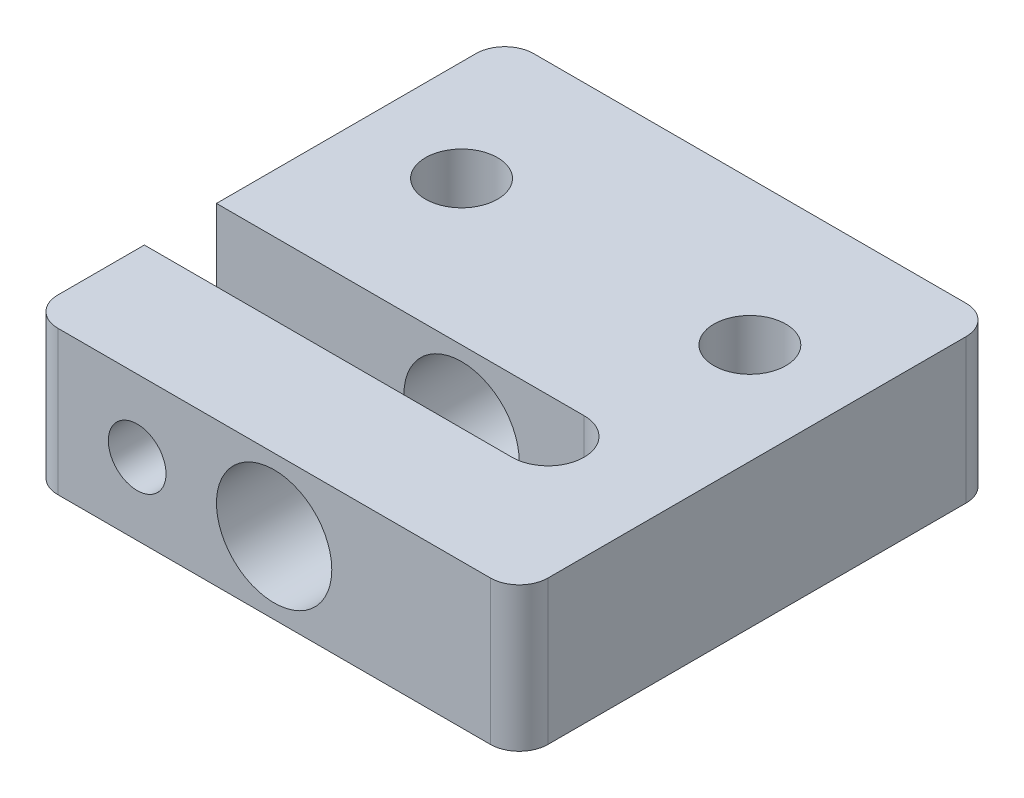
from build123d import *

# Parameters (mm, degrees)
SKETCH2_W           = 34
SKETCH2_H           = 33
BOSS_EXTRUDE1_DEPTH = 10
FILLET1_R           = 2
FILLET2_R           = 2
FILLET3_R           = 2
FILLET4_R           = 2
SKETCH3_R           = 2.5
CUT_EXTRUDE1_DEPTH  = 10
SKETCH4_W           = 28
SKETCH4_H           = 5
CUT_EXTRUDE2_DEPTH  = 10
FILLET5_R           = 2.5
FILLET6_R           = 2.5
SKETCH5_R           = 4
CUT_EXTRUDE3_DEPTH  = 60
SKETCH6_R           = 2
CUT_EXTRUDE4_DEPTH  = 10


with BuildPart() as part:
    # Sketch2 → Boss-Extrude1 (new body)
    with BuildSketch(Plane(origin=(0, 0, 0), x_dir=(1, 0, 0), z_dir=(0, 1, 0))):
        with Locations((17, 16.5)):
            Rectangle(SKETCH2_W, SKETCH2_H)
    extrude(amount=BOSS_EXTRUDE1_DEPTH)

    # Fillet1
    fillet1_edges = [part.edges().sort_by_distance(p)[0] for p in [
        (34, 5, 0),
    ]]
    fillet(fillet1_edges, radius=FILLET1_R)

    # Fillet2
    fillet2_edges = [part.edges().sort_by_distance(p)[0] for p in [
        (34, 5, -33),
    ]]
    fillet(fillet2_edges, radius=FILLET2_R)

    # Fillet3
    fillet3_edges = [part.edges().sort_by_distance(p)[0] for p in [
        (0, 5, -33),
    ]]
    fillet(fillet3_edges, radius=FILLET3_R)

    # Fillet4
    fillet4_edges = [part.edges().sort_by_distance(p)[0] for p in [
        (0, 5, 0),
    ]]
    fillet(fillet4_edges, radius=FILLET4_R)

    # Sketch3 → Cut-Extrude1 (cut)
    with BuildSketch(Plane(origin=(0, 10, 0), x_dir=(1, 0, 0), z_dir=(0, 1, 0))):
        with Locations(Location((7, 23, 0), (0, 0, 270))):
            Circle(SKETCH3_R)
        with Locations(Location((27, 23, 0), (0, 0, 270))):
            Circle(SKETCH3_R)
    extrude(amount=-CUT_EXTRUDE1_DEPTH, mode=Mode.SUBTRACT)

    # Sketch4 → Cut-Extrude2 (cut)
    with BuildSketch(Plane(origin=(0, 10, 0), x_dir=(1, 0, 0), z_dir=(0, 1, 0))):
        with Locations((14, 10.5)):
            Rectangle(SKETCH4_W, SKETCH4_H)
    extrude(amount=-CUT_EXTRUDE2_DEPTH, mode=Mode.SUBTRACT)

    # Fillet5
    fillet5_edges = [part.edges().sort_by_distance(p)[0] for p in [
        (28, 5, -13),
    ]]
    fillet(fillet5_edges, radius=FILLET5_R)

    # Fillet6
    fillet6_edges = [part.edges().sort_by_distance(p)[0] for p in [
        (28, 5, -8),
    ]]
    fillet(fillet6_edges, radius=FILLET6_R - 0.0001)  # a hair under: the kernel refuses the full size

    # Sketch5 → Cut-Extrude3 (cut)
    with BuildSketch(Plane.XY):
        with Locations((17, 5)):
            Circle(SKETCH5_R)
    extrude(amount=-CUT_EXTRUDE3_DEPTH, mode=Mode.SUBTRACT)

    # Sketch6 → Cut-Extrude4 (cut)
    with BuildSketch(Plane.XY):
        with Locations((7.5, 5)):
            Circle(SKETCH6_R)
    extrude(amount=-CUT_EXTRUDE4_DEPTH, mode=Mode.SUBTRACT)


solid = part.part
